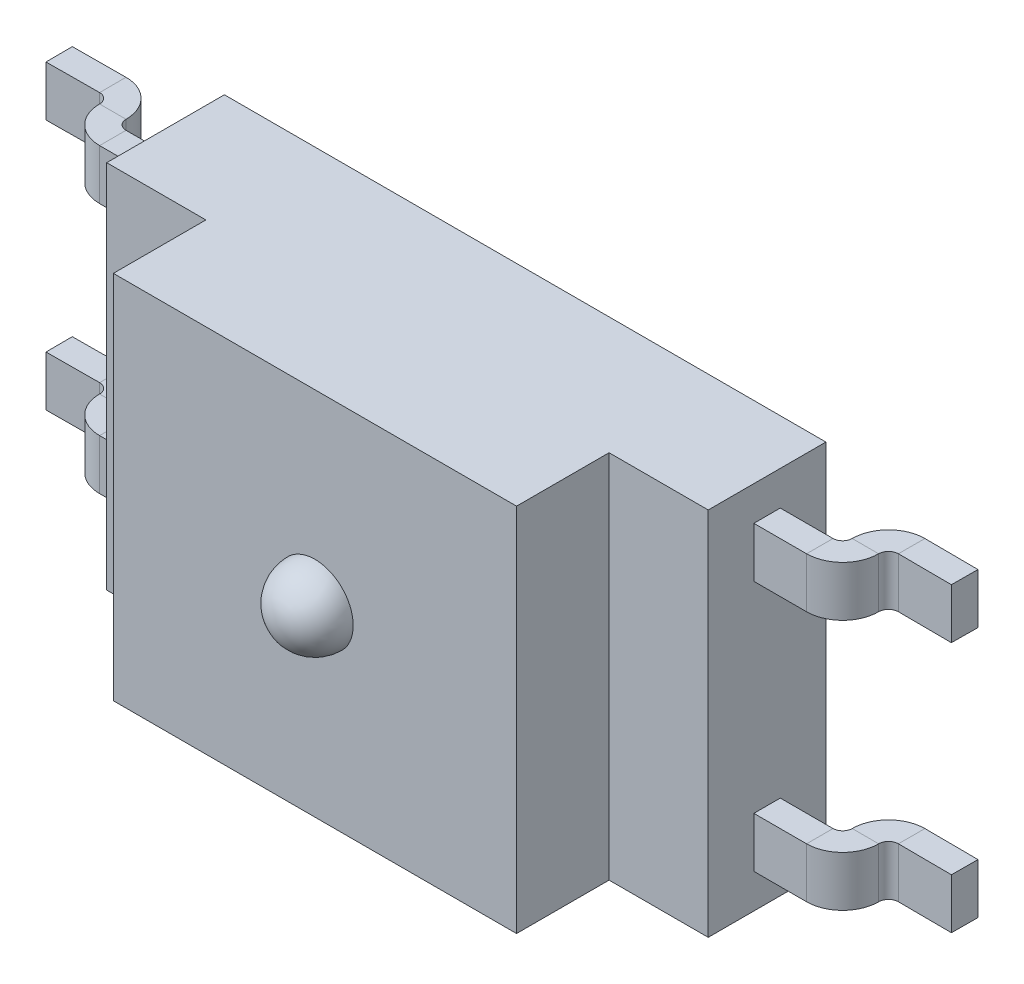
from build123d import *
from build123d.topology import SkipClean

# Parameters (mm, degrees)
SKETCH_1_W            = 9.1
SKETCH_1_H            = 5.6
EXTRUDE_1_DEPTH       = 1.78
SKETCH_2_W            = 6.1
SKETCH_2_H            = 5.6
EXTRUDE_2_DEPTH       = 1.4
SWEEP_START           = -2.28
SWEEP_2_DEPTH         = 0.76
MIRROR_START          = -2.28
MIRROR_2_COPY_1_DEPTH = 0.76


# Read off the part's stored shape, not the designer's step: 스윕2
with BuildPart() as part:
    # 스케치1 → 보스-돌출1 (new body)
    with BuildSketch(Plane.XY):
        Rectangle(SKETCH_1_W, SKETCH_1_H)
    extrude(amount=EXTRUDE_1_DEPTH)

    # 스케치2 → 보스-돌출2 (add)
    with BuildSketch(Plane.XY.offset(1.78)):
        Rectangle(SKETCH_2_W, SKETCH_2_H)
    extrude(amount=EXTRUDE_2_DEPTH)

    # 스케치3 → 회전1 (revolve)
    with SkipClean():  # the faces are left unmerged after this step: merging them gives an invalid solid
        with BuildSketch(Plane(origin=(0, 0, 0), x_dir=(1, 0, 0), z_dir=(0, 1, 0))):
            with BuildLine():
                Line((-0.579062876, -3.18), (0.579062876, -3.18))
                ThreePointArc((0.579062876, -3.18), (0, -3.759062876), (-0.579062876, -3.18))
            make_face()
        revolve(axis=Axis((-0.579062876, 0, 3.18), (1, 0, 0)))

    # 스윕2 outline → 스윕2 (add)
    with SkipClean():  # the faces are left unmerged after this step: merging them gives an invalid solid
        with BuildSketch(Plane(origin=(0, 0, 0), x_dir=(1, 0, 0), z_dir=(0, 1, 0)).offset(SWEEP_START)):
            with BuildLine():
                Line((6.848797328, -0.399996384), (6.851202672, -3.616e-06))
                Line((6.851202672, -3.616e-06), (6.043424326, 0.004853607))
                ThreePointArc((6.043424326, 0.004853607), (5.654230205, -0.155982007), (5.492969053, -0.545))
                ThreePointArc((5.492969053, -0.545), (5.450499536, -0.647530483), (5.347969053, -0.69))
                Line((5.347969053, -0.69), (4.55, -0.69))
                Line((4.55, -0.69), (4.55, -1.09))
                Line((4.55, -1.09), (5.347969053, -1.09))
                ThreePointArc((5.347969053, -1.09), (5.733342249, -0.930373196), (5.892969053, -0.545))
                ThreePointArc((5.892969053, -0.545), (5.936647868, -0.439250079), (6.042221667, -0.395147271))
                Line((6.042221667, -0.395147271), (6.848797328, -0.399996384))
            make_face()
        sweep_2 = extrude(amount=SWEEP_2_DEPTH)

    # 대칭 복사1: 스윕2 across plane
    with SkipClean():  # the faces are left unmerged after this step: merging them gives an invalid solid
        add(sweep_2.mirror(Plane.ZX))

    # 대칭 복사2: 스윕2 across plane
    with SkipClean():  # the faces are left unmerged after this step: merging them gives an invalid solid
        add(sweep_2.mirror(Plane(origin=(0, 0, 0), x_dir=(0, 0, 1), z_dir=(1, 0, 0))))

    # 대칭 복사2 copy 1 sketch → 대칭 복사2 copy 1 (add)
    with SkipClean():  # the faces are left unmerged after this step: merging them gives an invalid solid
        with BuildSketch(Plane(origin=(0, 0, 0), x_dir=(-1, 0, 0), z_dir=(0, -1, 0)).offset(MIRROR_START)):
            with BuildLine():
                Line((6.848797328, -0.399996384), (6.851202672, -3.616e-06))
                Line((6.851202672, -3.616e-06), (6.043424326, 0.004853607))
                ThreePointArc((6.043424326, 0.004853607), (5.654230205, -0.155982007), (5.492969053, -0.545))
                ThreePointArc((5.492969053, -0.545), (5.450499536, -0.647530483), (5.347969053, -0.69))
                Line((5.347969053, -0.69), (4.55, -0.69))
                Line((4.55, -0.69), (4.55, -1.09))
                Line((4.55, -1.09), (5.347969053, -1.09))
                ThreePointArc((5.347969053, -1.09), (5.733342249, -0.930373196), (5.892969053, -0.545))
                ThreePointArc((5.892969053, -0.545), (5.936647868, -0.439250079), (6.042221667, -0.395147271))
                Line((6.042221667, -0.395147271), (6.848797328, -0.399996384))
            make_face()
        extrude(amount=MIRROR_2_COPY_1_DEPTH)


solid = part.part
